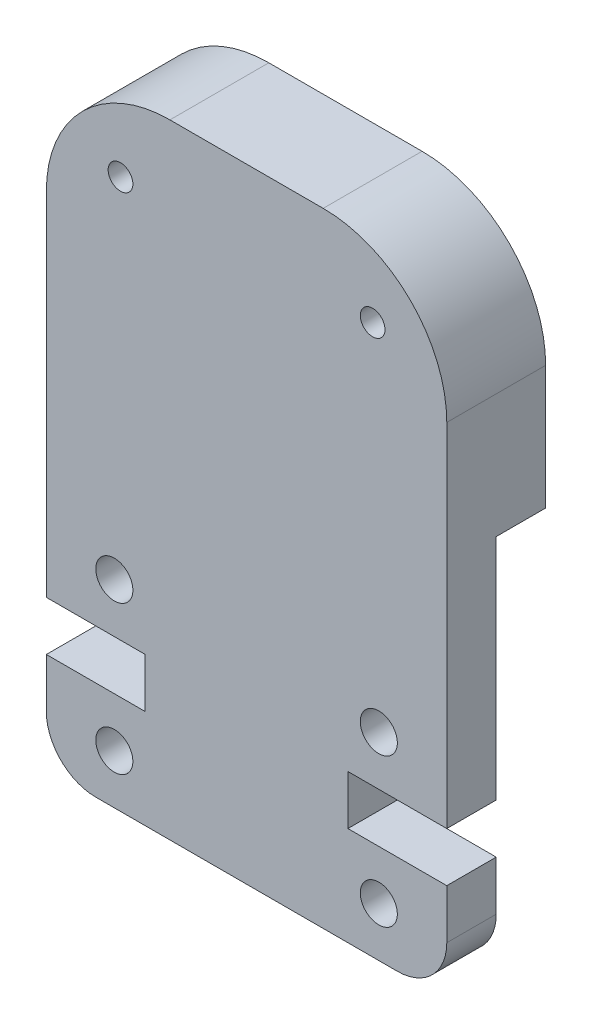
from build123d import *

# Parameters (mm, degrees)
SKETCH1_R           = 0.75
SKETCH1_R_2         = 0.5
BOSS_EXTRUDE1_DEPTH = 4
SKETCH2_W           = 16.2
SKETCH2_H           = 15.23
CUT_EXTRUDE1_DEPTH  = 2


with BuildPart() as part:
    # Sketch1 → Boss-Extrude1 (new body)
    with BuildSketch(Plane.XY):
        with BuildLine():
            Line((2, 0), (14.2, 0))
            ThreePointArc((14.2, 0), (15.614213562, 0.585786438), (16.2, 2))
            Line((16.2, 2), (16.2, 4))
            Line((16.2, 4), (12.2, 4))
            Line((12.2, 4), (12.2, 6))
            Line((12.2, 6), (16.2, 6))
            Line((16.2, 6), (16.2, 20.23))
            ThreePointArc((16.2, 20.23), (14.735533906, 23.765533906), (11.2, 25.23))
            Line((11.2, 25.23), (5, 25.23))
            ThreePointArc((5, 25.23), (1.464466094, 23.765533906), (0, 20.23))
            Line((0, 20.23), (0, 6))
            Line((0, 6), (4, 6))
            Line((4, 6), (4, 4))
            Line((4, 4), (0, 4))
            Line((0, 4), (0, 2))
            ThreePointArc((0, 2), (0.585786438, 0.585786438), (2, 0))
        make_face()
        with Locations((13.45, 2)):
            Circle(SKETCH1_R, mode=Mode.SUBTRACT)
        with Locations((13.2, 22.23)):
            Circle(SKETCH1_R_2, mode=Mode.SUBTRACT)
        with Locations((2.75, 8)):
            Circle(SKETCH1_R, mode=Mode.SUBTRACT)
        with Locations((13.45, 8)):
            Circle(SKETCH1_R, mode=Mode.SUBTRACT)
        with Locations((3, 22.23)):
            Circle(SKETCH1_R_2, mode=Mode.SUBTRACT)
        with Locations((2.75, 2)):
            Circle(SKETCH1_R, mode=Mode.SUBTRACT)
    extrude(amount=BOSS_EXTRUDE1_DEPTH)

    # Sketch2 → Cut-Extrude1 (cut)
    with BuildSketch(Plane.XY):
        with Locations((8.1, 7.615)):
            Rectangle(SKETCH2_W, SKETCH2_H)
    extrude(amount=CUT_EXTRUDE1_DEPTH, mode=Mode.SUBTRACT)


solid = part.part
